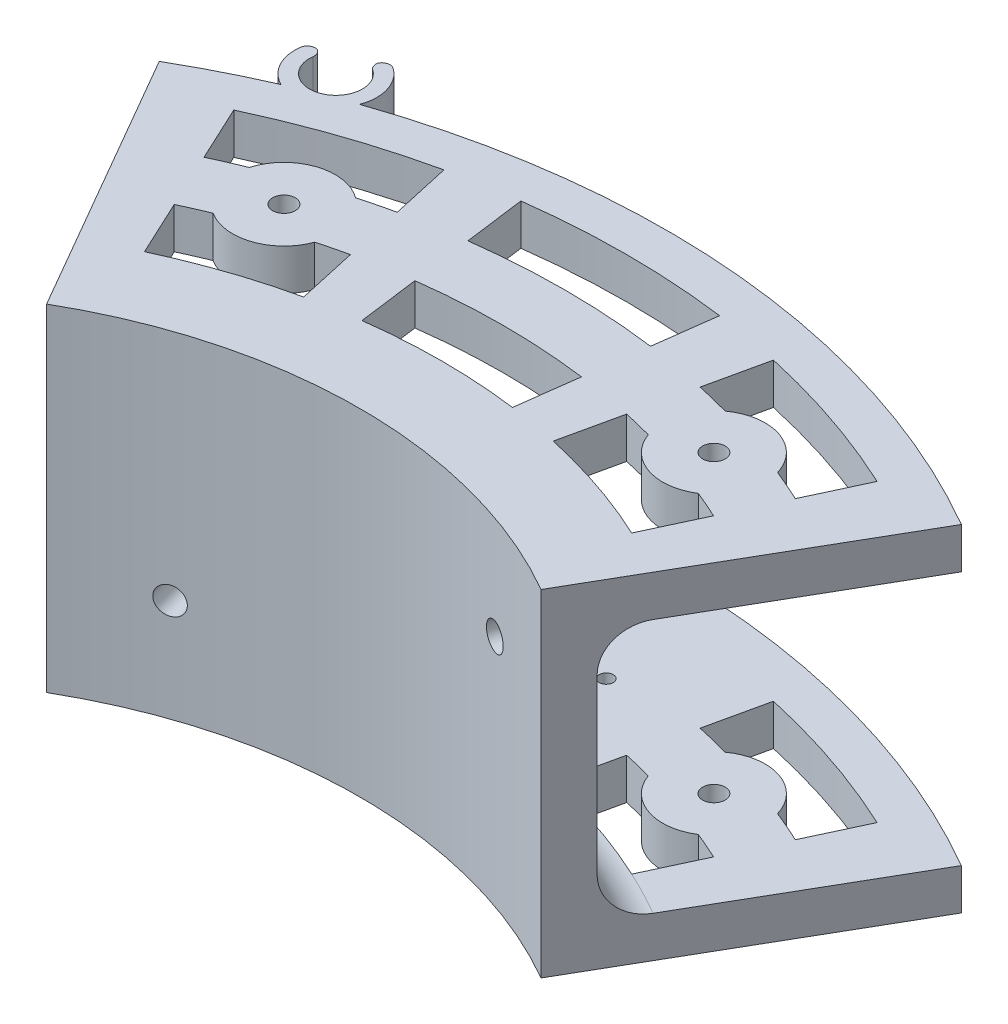
from build123d import *

# Parameters (mm, degrees)
SALIENTE_EXTRUIR1_DEPTH                = 10
CROQUIS5_W                             = 37
CROQUIS5_H                             = 22.5
CORTAR_EXTRUIR1_DEPTH                  = 5
TALADRO_DE_MARGEN_PARA_M31_D           = 3.4
TALADRO_DE_MARGEN_PARA_M31_CSINK_D     = 3.45
TALADRO_DE_MARGEN_PARA_M31_CSINK_ANGLE = 90
SALIENTE_EXTRUIR2_DEPTH                = 62
SALIENTE_EXTRUIR3_DEPTH                = 10
REDONDEO2_R                            = 10
CORTAR_EXTRUIR2_DEPTH                  = 10
CORTAR_EXTRUIR3_START                  = -10
CORTAR_EXTRUIR3_DEPTH                  = 10
TALADRO_DE_MARGEN_PARA_M61_D           = 6.6
TALADRO_DE_MARGEN_PARA_M61_CSINK_D     = 6.65
TALADRO_DE_MARGEN_PARA_M61_CSINK_ANGLE = 90
TALADRO_START                          = -130.385063418
TALADRO_DE_MARGEN_PARA_M62_OUTLINE_R   = 3.3
TALADRO_DE_MARGEN_PARA_M62_DEPTH       = 10.491681749
CROQUIS25_R                            = 12.5
SALIENTE_EXTRUIR4_DEPTH                = 10
SALIENTE_EXTRUIR5_START                = -10
CROQUIS26_R                            = 12.5
SALIENTE_EXTRUIR5_DEPTH                = 10
TALADRO_DE_MARGEN_PARA_M51_D           = 5.5
SALIENTE_EXTRUIR6_DEPTH                = 10
REDONDEO3_R                            = 2


# Read off the part's stored shape, not the designer's step: Taladro de margen para M62
with BuildPart() as part:
    # Croquis1 → Saliente-Extruir1 (new body)
    with BuildSketch(Plane(origin=(0, 0, 0), x_dir=(1, 0, 0), z_dir=(0, 1, 0))):
        with BuildLine():
            Line((-97.75, 169.30796644), (-60.25, 104.356061156))
            ThreePointArc((-60.25, 104.356061156), (0, 120.5), (60.25, 104.356061156))
            Line((60.25, 104.356061156), (97.75, 169.30796644))
            ThreePointArc((97.75, 169.30796644), (0, 195.5), (-97.75, 169.30796644))
        make_face()
    extrude(amount=SALIENTE_EXTRUIR1_DEPTH)

    # Croquis5 → Cortar-Extruir1 (cut)
    with BuildSketch(Plane.XZ):
        with Locations((0, -158)):
            Rectangle(CROQUIS5_W, CROQUIS5_H)
    extrude(amount=-CORTAR_EXTRUIR1_DEPTH, mode=Mode.SUBTRACT)

    # Taladro de margen para M31 (through all)
    with Locations(Plane(origin=(0, 5, 0), x_dir=(-1, 0, 0), z_dir=(0, -1, 0))):
        with Locations((-15, 165.5), (-15, 150.5), (15, 150.5), (15, 165.5)):
            CounterSinkHole(TALADRO_DE_MARGEN_PARA_M31_D / 2, TALADRO_DE_MARGEN_PARA_M31_CSINK_D / 2, counter_sink_angle=TALADRO_DE_MARGEN_PARA_M31_CSINK_ANGLE)

    # Croquis14 → Saliente-Extruir2 (add)
    with BuildSketch(Plane(origin=(0, 10, 0), x_dir=(1, 0, 0), z_dir=(0, 1, 0))):
        with BuildLine():
            Line((-65.25, 113.016315194), (-60.25, 104.356061156))
            ThreePointArc((-60.25, 104.356061156), (0, 120.5), (60.25, 104.356061156))
            Line((60.25, 104.356061156), (65.25, 113.016315194))
            ThreePointArc((65.25, 113.016315194), (0, 130.5), (-65.25, 113.016315194))
        make_face()
    extrude(amount=SALIENTE_EXTRUIR2_DEPTH)

    # Croquis15 → Saliente-Extruir3 (add)
    with BuildSketch(Plane(origin=(0, 72, 0), x_dir=(1, 0, 0), z_dir=(0, 1, 0))):
        with BuildLine():
            Line((-97.75, 169.30796644), (-60.25, 104.356061156))
            ThreePointArc((-60.25, 104.356061156), (0, 120.5), (60.25, 104.356061156))
            Line((60.25, 104.356061156), (97.75, 169.30796644))
            ThreePointArc((97.75, 169.30796644), (0, 195.5), (-97.75, 169.30796644))
        make_face()
    extrude(amount=SALIENTE_EXTRUIR3_DEPTH)

    # Redondeo2
    redondeo2_edges = [part.edges().sort_by_distance(p)[0] for p in [
        (0, 10, -130.5),
        (0, 72, -130.5),
    ]]
    fillet(redondeo2_edges, radius=REDONDEO2_R)

    # Croquis16 → Cortar-Extruir2 (cut)
    with BuildSketch(Plane(origin=(0, 82, 0), x_dir=(1, 0, 0), z_dir=(0, 1, 0))):
        with BuildLine():
            Line((-78.395687553, 168.120094495), (-72.056413627, 154.52547769))
            ThreePointArc((-72.056413627, 154.52547769), (-54.805428834, 161.451587079), (-36.902954176, 166.458469214))
            Line((-36.902954176, 166.458469214), (-40.149548386, 181.102909321))
            ThreePointArc((-40.149548386, 181.102909321), (-59.627020814, 175.655539021), (-78.395687553, 168.120094495))
        make_face()
        with BuildLine():
            Line((-65.717139701, 140.930860884), (-59.377865775, 127.336244079))
            ThreePointArc((-59.377865775, 127.336244079), (-45.162244875, 133.043683194), (-30.409765758, 137.169589))
            Line((-30.409765758, 137.169589), (-33.656359967, 151.814029107))
            ThreePointArc((-33.656359967, 151.814029107), (-49.983836855, 147.247635136), (-65.717139701, 140.930860884))
        make_face()
        with BuildLine():
            Line((-24.212608657, 183.913021785), (-22.254715774, 169.041348864))
            ThreePointArc((-22.254715774, 169.041348864), (0, 170.5), (22.254715774, 169.041348864))
            Line((22.254715774, 169.041348864), (24.212608657, 183.913021785))
            ThreePointArc((24.212608657, 183.913021785), (0, 185.5), (-24.212608657, 183.913021785))
        make_face()
        with BuildLine():
            Line((-20.29682289, 154.169675944), (-18.338930007, 139.298003023))
            ThreePointArc((-18.338930007, 139.298003023), (0, 140.5), (18.338930007, 139.298003023))
            Line((18.338930007, 139.298003023), (20.29682289, 154.169675944))
            ThreePointArc((20.29682289, 154.169675944), (0, 155.5), (-20.29682289, 154.169675944))
        make_face()
        with BuildLine():
            Line((40.149548386, 181.102909321), (36.902954176, 166.458469214))
            ThreePointArc((36.902954176, 166.458469214), (54.805428834, 161.451587079), (72.056413627, 154.52547769))
            Line((72.056413627, 154.52547769), (78.395687553, 168.120094495))
            ThreePointArc((78.395687553, 168.120094495), (59.627020814, 175.655539021), (40.149548386, 181.102909321))
        make_face()
        with BuildLine():
            Line((33.656359967, 151.814029107), (30.409765758, 137.169589))
            ThreePointArc((30.409765758, 137.169589), (45.162244875, 133.043683194), (59.377865775, 127.336244079))
            Line((59.377865775, 127.336244079), (65.717139701, 140.930860884))
            ThreePointArc((65.717139701, 140.930860884), (49.983836855, 147.247635136), (33.656359967, 151.814029107))
        make_face()
    extrude(amount=-CORTAR_EXTRUIR2_DEPTH, mode=Mode.SUBTRACT)

    # Croquis19 → Cortar-Extruir3 (cut)
    with BuildSketch(Plane.XZ.offset(CORTAR_EXTRUIR3_START)):
        with BuildLine():
            Line((72.056413627, -154.52547769), (78.395687553, -168.120094495))
            ThreePointArc((78.395687553, -168.120094495), (59.627020814, -175.655539021), (40.149548386, -181.102909321))
            Line((40.149548386, -181.102909321), (36.902954176, -166.458469214))
            ThreePointArc((36.902954176, -166.458469214), (54.805428834, -161.451587079), (72.056413627, -154.52547769))
        make_face()
        with BuildLine():
            Line((59.377865775, -127.336244079), (65.717139701, -140.930860884))
            ThreePointArc((65.717139701, -140.930860884), (49.983836855, -147.247635136), (33.656359967, -151.814029107))
            Line((33.656359967, -151.814029107), (30.409765758, -137.169589))
            ThreePointArc((30.409765758, -137.169589), (45.162244875, -133.043683194), (59.377865775, -127.336244079))
        make_face()
        with BuildLine():
            Line((-78.395687553, -168.120094495), (-72.056413627, -154.52547769))
            ThreePointArc((-72.056413627, -154.52547769), (-54.805428834, -161.451587079), (-36.902954176, -166.458469214))
            Line((-36.902954176, -166.458469214), (-40.149548386, -181.102909321))
            ThreePointArc((-40.149548386, -181.102909321), (-59.627020814, -175.655539021), (-78.395687553, -168.120094495))
        make_face()
        with BuildLine():
            Line((-65.717139701, -140.930860884), (-59.377865775, -127.336244079))
            ThreePointArc((-59.377865775, -127.336244079), (-45.162244875, -133.043683194), (-30.409765758, -137.169589))
            Line((-30.409765758, -137.169589), (-33.656359967, -151.814029107))
            ThreePointArc((-33.656359967, -151.814029107), (-49.983836855, -147.247635136), (-65.717139701, -140.930860884))
        make_face()
    extrude(amount=CORTAR_EXTRUIR3_DEPTH, mode=Mode.SUBTRACT)

    # Taladro de margen para M61 (through all)
    with Locations(Plane(origin=(33.775885386, 0, -126.053320331), x_dir=(0, -1, 0), z_dir=(0.2588190451025245, 0, -0.9659258262890673))):
        with Locations((-57, -8.775885386)):
            CounterSinkHole(TALADRO_DE_MARGEN_PARA_M61_D / 2, TALADRO_DE_MARGEN_PARA_M61_CSINK_D / 2, counter_sink_angle=TALADRO_DE_MARGEN_PARA_M61_CSINK_ANGLE)

    # Taladro de margen para M62 outline → Taladro de margen para M62 (cut)
    with BuildSketch(Plane(origin=(0, 0, 0), x_dir=(0.9659258262890672, 0, -0.2588190451025251), z_dir=(0.25881904510252507, 0, 0.9659258262890672)).offset(TALADRO_START)):
        with Locations((-8.775885386, 25)):
            Circle(TALADRO_DE_MARGEN_PARA_M62_OUTLINE_R)
    extrude(amount=TALADRO_DE_MARGEN_PARA_M62_DEPTH, mode=Mode.SUBTRACT)

    # Croquis25 → Saliente-Extruir4 (add)
    with BuildSketch(Plane(origin=(0, 82, 0), x_dir=(1, 0, 0), z_dir=(0, 1, 0))):
        with Locations((-52.394632844, 154.349611108)):
            Circle(CROQUIS25_R)
        with Locations((52.394632844, 154.349611108)):
            Circle(CROQUIS25_R)
    extrude(amount=-SALIENTE_EXTRUIR4_DEPTH)

    # Croquis26 → Saliente-Extruir5 (add)
    with BuildSketch(Plane.XZ.offset(SALIENTE_EXTRUIR5_START)):
        with Locations((-52.394632844, -154.349611108)):
            Circle(CROQUIS26_R)
        with Locations((52.394632844, -154.349611108)):
            Circle(CROQUIS26_R)
    extrude(amount=SALIENTE_EXTRUIR5_DEPTH)

    # Taladro de margen para M51 (through all)
    with Locations(Plane(origin=(0, 82, 0), x_dir=(1, 0, 0), z_dir=(0, 1, 0))):
        with Locations((-52.394632844, 154.349611108), (52.394632844, 154.349611108)):
            Hole(TALADRO_DE_MARGEN_PARA_M51_D / 2)

    # Croquis29 → Saliente-Extruir6 (add)
    with BuildSketch(Plane(origin=(0, 82, 0), x_dir=(1, 0, 0), z_dir=(0, 1, 0))):
        with BuildLine():
            Line((-82.926991651, 191.845896293), (-79.618434834, 190.55905839))
            ThreePointArc((-79.618434834, 190.55905839), (-71.00972345, 182.317098184), (-71.269055695, 194.232322333))
            Line((-71.269055695, 194.232322333), (-69.982217792, 197.54087915))
            ThreePointArc((-69.982217792, 197.54087915), (-69.580152297, 179.067663415), (-82.926991651, 191.845896293))
        make_face()
    extrude(amount=-SALIENTE_EXTRUIR6_DEPTH)

    # Redondeo3
    # the kernel refuses this fillet: 2 mm, written as the material it takes off along each edge
    with BuildSketch(Plane(origin=(-69.982217792, 88.300214624, -197.54087915), x_dir=(0.8788843703548711, 0, 0.477034866174289), z_dir=(0, -1, 0))) as redondeo3_piece_1:
        with BuildLine():
            CenterArc((2.268077265, 1.984059393), REDONDEO3_R, 172.761243907, 104.477512186)
            Line((0.284017872, 2.236067977), (0, 0))
            ThreePointArc((0, 0), (1.260042925, -0.079703037), (2.52008585, 0))
        make_face()
    extrude(amount=22.600429248, mode=Mode.SUBTRACT)
    with BuildSketch(Plane(origin=(-71.269055695, 86.399756393, -194.232322333), x_dir=(0.3624895501390437, 0, -0.9319878357789836), z_dir=(0, -1, 0))) as redondeo3_piece_2:
        with BuildLine():
            CenterArc((1.759902557, 2), REDONDEO3_R, 193.691050596, 76.308949404)
            ThreePointArc((-0.183269646, 1.526627219), (-0.045981309, 0.768794255), (0, 0))
            Line((0, 0), (1.759902557, 0))
        make_face()
    extrude(amount=18.799512786, mode=Mode.SUBTRACT)
    with BuildSketch(Plane(origin=(-79.618434834, 86.399756393, -190.55905839), x_dir=(-0.931987835778983, 0, -0.3624895501390453), z_dir=(0, -1, 0))) as redondeo3_piece_3:
        with BuildLine():
            CenterArc((1.759902557, -2), REDONDEO3_R, 90, 76.308949404)
            ThreePointArc((-0.183269646, -1.526627219), (-0.045981309, -0.768794255), (0, 0))
            Line((0, 0), (1.759902557, 0))
        make_face()
    extrude(amount=18.799512786, mode=Mode.SUBTRACT)
    with BuildSketch(Plane(origin=(-82.926991651, 88.300214624, -191.845896293), x_dir=(-0.2421659304746274, 0, 0.9702348489501693), z_dir=(0, -1, 0))) as redondeo3_piece_4:
        with BuildLine():
            CenterArc((2.268077265, -1.984059393), REDONDEO3_R, 82.761243907, 104.477512186)
            Line((0.284017872, -2.236067977), (0, 0))
            ThreePointArc((0, 0), (1.260042925, 0.079703037), (2.52008585, 0))
        make_face()
    extrude(amount=22.600429248, mode=Mode.SUBTRACT)


solid = part.part
